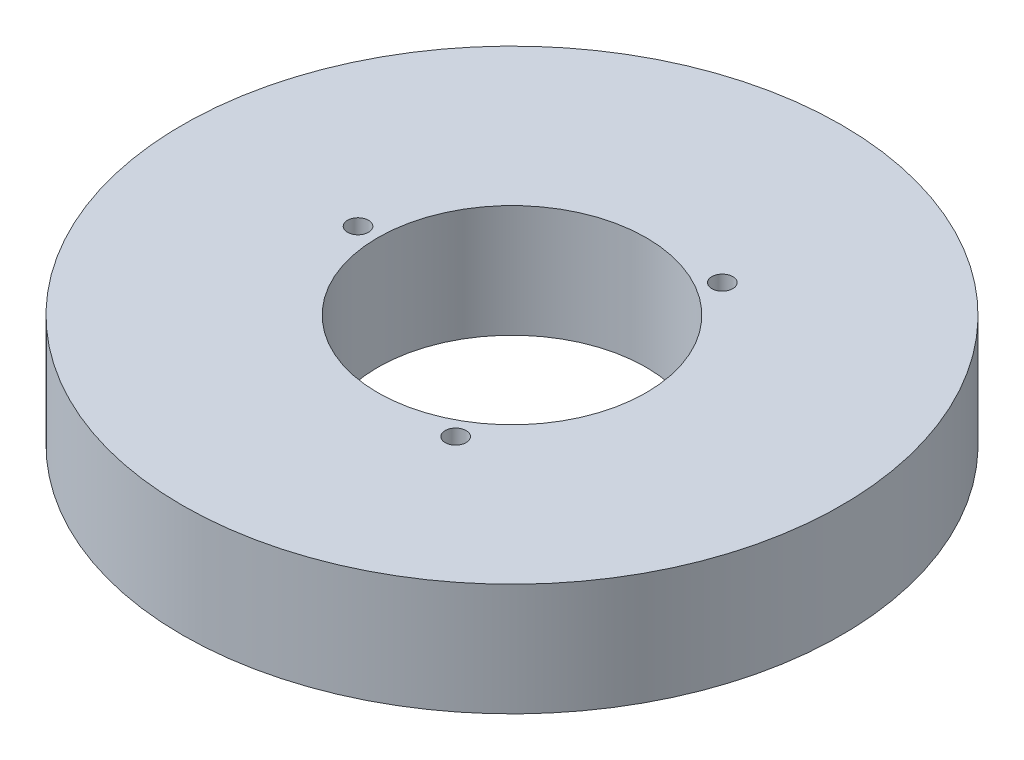
from build123d import *

# Parameters (mm, degrees)
SKETCH1_R           = 67.5
BOSS_EXTRUDE1_DEPTH = 23
SKETCH2_R           = 27.5
CUT_EXTRUDE1_DEPTH  = 99.19114013
SKETCH3_R           = 2.147329469
CUT_EXTRUDE2_DEPTH  = 14.338957893
CIRPATTERN1_COUNT   = 3


with BuildPart() as part:
    # Sketch1 → Boss-Extrude1 (new body)
    with BuildSketch(Plane(origin=(0, 0, 0), x_dir=(1, 0, 0), z_dir=(0, 1, 0))):
        Circle(SKETCH1_R)
    extrude(amount=BOSS_EXTRUDE1_DEPTH)

    # Sketch2 → Cut-Extrude1 (cut, through all)
    with BuildSketch(Plane(origin=(0, 0, 0), x_dir=(1, 0, 0), z_dir=(0, 1, 0))):
        Circle(SKETCH2_R)
    extrude(amount=CUT_EXTRUDE1_DEPTH, mode=Mode.SUBTRACT)

    # Sketch3 → Cut-Extrude2 (cut)
    with BuildSketch(Plane(origin=(0, 23, 0), x_dir=(1, 0, 0), z_dir=(0, 1, 0))):
        with Locations((-31.533992457, 0)):
            Circle(SKETCH3_R)
    cut_extrude2 = extrude(amount=-CUT_EXTRUDE2_DEPTH, mode=Mode.SUBTRACT)

    # CirPattern1: Cut-Extrude2 ×3 about axis
    cirpattern1_axis = Axis((0, 0, 0), (0, 1, 0))
    for i in range(1, CIRPATTERN1_COUNT):
        add(cut_extrude2.rotate(cirpattern1_axis, i * 360 / CIRPATTERN1_COUNT), mode=Mode.SUBTRACT)


solid = part.part
